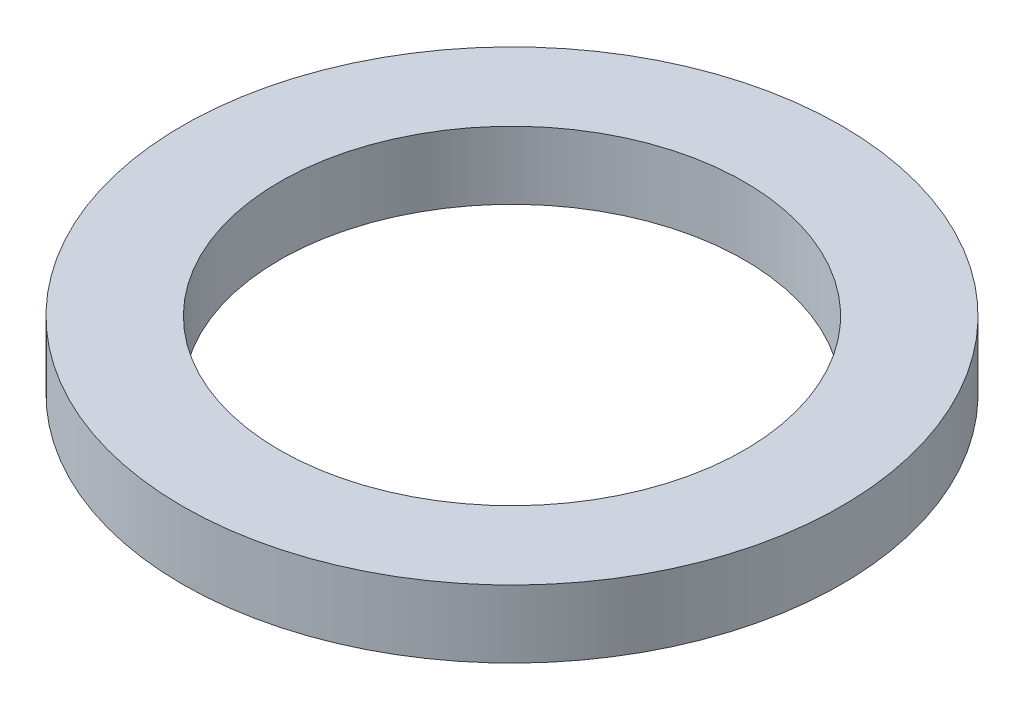
from build123d import *

# Parameters (mm, degrees)
SKETCH1_R           = 3.9
BOSS_EXTRUDE1_DEPTH = 0.8
SKETCH2_R           = 2.75
CUT_EXTRUDE1_DEPTH  = 6.573149917


with BuildPart() as part:
    # Sketch1 → Boss-Extrude1 (new body)
    with BuildSketch(Plane(origin=(0, 0, 0), x_dir=(1, 0, 0), z_dir=(0, 1, 0))):
        Circle(SKETCH1_R)
    extrude(amount=BOSS_EXTRUDE1_DEPTH)

    # Sketch2 → Cut-Extrude1 (cut, through all)
    with BuildSketch(Plane(origin=(0, 0.8, 0), x_dir=(1, 0, 0), z_dir=(0, 1, 0))):
        Circle(SKETCH2_R)
    extrude(amount=-CUT_EXTRUDE1_DEPTH, mode=Mode.SUBTRACT)


solid = part.part
